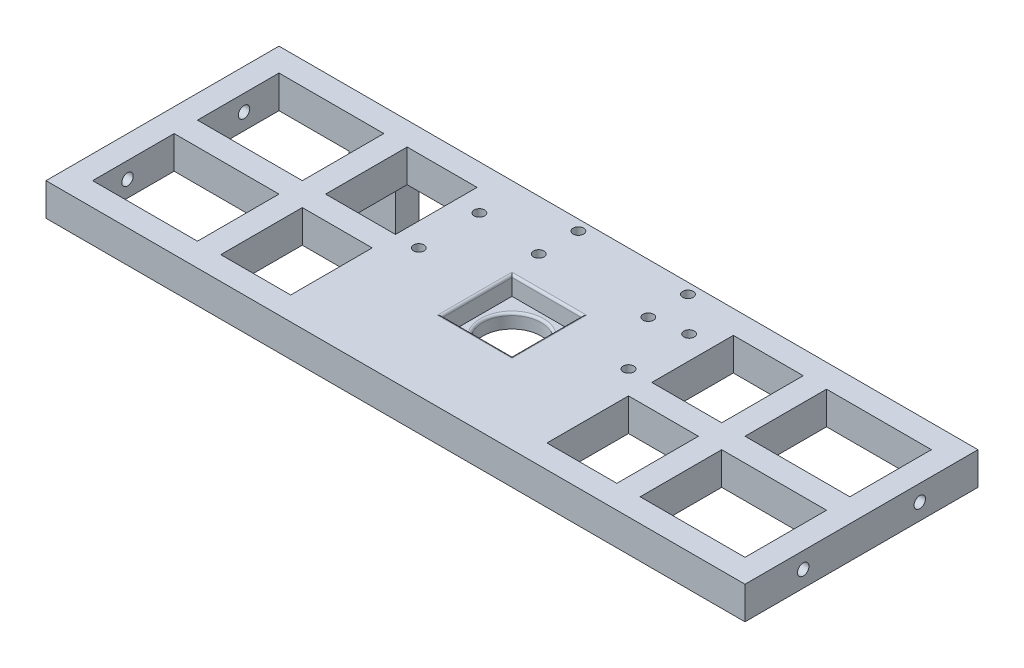
from build123d import *

# Parameters (mm, degrees)
SKETCH_1_W           = 300
SKETCH_1_H           = 100
EXTRUDE_1_DEPTH      = 16
SKETCH_2_W           = 30
SKETCH_2_H           = 30
CUT_EXTRUDE_1_DEPTH  = 8
SKETCH_3_R           = 12.5
CUT_EXTRUDE_2_DEPTH  = 14
CUT_EXTRUDE_3_REACH  = 318.632
SKETCH_4_W           = 50
SKETCH_4_H           = 35
SKETCH_7_W           = 35
SKETCH_7_H           = 16
EXTRUDE_2_DEPTH      = 20
SKETCH_8_W           = 35
SKETCH_8_H           = 16
EXTRUDE_3_DEPTH      = 20
SKETCH_9_W           = 20
SKETCH_9_H           = 10
EXTRUDE_4_DEPTH      = 25
FILLET_1_R           = 1
FILLET_2_R           = 1
SKETCH_13_W          = 35
SKETCH_13_H          = 16
EXTRUDE_6_DEPTH      = 4
SKETCH_14_W          = 35
SKETCH_14_H          = 16
EXTRUDE_7_DEPTH      = 4
SKETCH_17_W          = 35
SKETCH_17_H          = 16
EXTRUDE_8_DEPTH      = 1
SKETCH_18_W          = 35
SKETCH_18_H          = 16
EXTRUDE_9_DEPTH      = 1
CUT_EXTRUDE_15_DEPTH = 2
SKETCH_28_R          = 2.25
CUT_EXTRUDE_18_DEPTH = 5
SKETCH_30_R          = 1.5
CUT_EXTRUDE_20_DEPTH = 4
SKETCH_33_R          = 2.45
CUT_EXTRUDE_22_DEPTH = 13.2
CUT_EXTRUDE_START    = -13.2
SKETCH_34_R          = 2.45
CUT_EXTRUDE_23_DEPTH = 13.2


with BuildPart() as part:
    # 草图1 → 凸台-拉伸1 (new body)
    with BuildSketch(Plane(origin=(0, 0, 0), x_dir=(1, 0, 0), z_dir=(0, 1, 0))):
        with Locations((-150, 50)):
            Rectangle(SKETCH_1_W, SKETCH_1_H)
    extrude(amount=EXTRUDE_1_DEPTH)

    # 草图2 → 切除-拉伸1 (cut)
    with BuildSketch(Plane(origin=(0, 16, 0), x_dir=(1, 0, 0), z_dir=(0, 1, 0))):
        with Locations((-150, 50)):
            Rectangle(SKETCH_2_W, SKETCH_2_H)
    extrude(amount=-CUT_EXTRUDE_1_DEPTH, mode=Mode.SUBTRACT)

    # 草图3 → 切除-拉伸2 (cut)
    with BuildSketch(Plane(origin=(0, 8, 0), x_dir=(1, 0, 0), z_dir=(0, 1, 0))):
        with Locations((-150, 50)):
            Circle(SKETCH_3_R)
    extrude(amount=-CUT_EXTRUDE_2_DEPTH, mode=Mode.SUBTRACT)

    # 草图4 → 切除-拉伸3 (cut, up to next)
    with BuildSketch(Plane(origin=(0, 16, 0), x_dir=(1, 0, 0), z_dir=(0, 1, 0)), mode=Mode.PRIVATE) as cut_extrude_3_sk1:
        with Locations((-270, 72.5)):
            Rectangle(SKETCH_4_W, SKETCH_4_H)
    cut_extrude_3_tool1 = extrude(cut_extrude_3_sk1.sketch, amount=-CUT_EXTRUDE_3_REACH, mode=Mode.PRIVATE) & part.part
    # 草图4 → 切除-拉伸3 (cut, up to next)
    with BuildSketch(Plane(origin=(0, 16, 0), x_dir=(1, 0, 0), z_dir=(0, 1, 0)), mode=Mode.PRIVATE) as cut_extrude_3_sk2:
        with Locations((-270, 27.5)):
            Rectangle(SKETCH_4_W, SKETCH_4_H)
    cut_extrude_3_tool2 = extrude(cut_extrude_3_sk2.sketch, amount=-CUT_EXTRUDE_3_REACH, mode=Mode.PRIVATE) & part.part
    # 草图4 → 切除-拉伸3 (cut, up to next)
    with BuildSketch(Plane(origin=(0, 16, 0), x_dir=(1, 0, 0), z_dir=(0, 1, 0)), mode=Mode.PRIVATE) as cut_extrude_3_sk3:
        with Locations((-210, 72.5)):
            Rectangle(SKETCH_4_W, SKETCH_4_H)
    cut_extrude_3_tool3 = extrude(cut_extrude_3_sk3.sketch, amount=-CUT_EXTRUDE_3_REACH, mode=Mode.PRIVATE) & part.part
    # 草图4 → 切除-拉伸3 (cut, up to next)
    with BuildSketch(Plane(origin=(0, 16, 0), x_dir=(1, 0, 0), z_dir=(0, 1, 0)), mode=Mode.PRIVATE) as cut_extrude_3_sk4:
        with Locations((-210, 27.5)):
            Rectangle(SKETCH_4_W, SKETCH_4_H)
    cut_extrude_3_tool4 = extrude(cut_extrude_3_sk4.sketch, amount=-CUT_EXTRUDE_3_REACH, mode=Mode.PRIVATE) & part.part
    # 草图4 → 切除-拉伸3 (cut, up to next)
    with BuildSketch(Plane(origin=(0, 16, 0), x_dir=(1, 0, 0), z_dir=(0, 1, 0)), mode=Mode.PRIVATE) as cut_extrude_3_sk5:
        with Locations((-30, 27.5)):
            Rectangle(SKETCH_4_W, SKETCH_4_H)
    cut_extrude_3_tool5 = extrude(cut_extrude_3_sk5.sketch, amount=-CUT_EXTRUDE_3_REACH, mode=Mode.PRIVATE) & part.part
    # 草图4 → 切除-拉伸3 (cut, up to next)
    with BuildSketch(Plane(origin=(0, 16, 0), x_dir=(1, 0, 0), z_dir=(0, 1, 0)), mode=Mode.PRIVATE) as cut_extrude_3_sk6:
        with Locations((-90, 27.5)):
            Rectangle(SKETCH_4_W, SKETCH_4_H)
    cut_extrude_3_tool6 = extrude(cut_extrude_3_sk6.sketch, amount=-CUT_EXTRUDE_3_REACH, mode=Mode.PRIVATE) & part.part
    # 草图4 → 切除-拉伸3 (cut, up to next)
    with BuildSketch(Plane(origin=(0, 16, 0), x_dir=(1, 0, 0), z_dir=(0, 1, 0)), mode=Mode.PRIVATE) as cut_extrude_3_sk7:
        with Locations((-90, 72.5)):
            Rectangle(SKETCH_4_W, SKETCH_4_H)
    cut_extrude_3_tool7 = extrude(cut_extrude_3_sk7.sketch, amount=-CUT_EXTRUDE_3_REACH, mode=Mode.PRIVATE) & part.part
    # 草图4 → 切除-拉伸3 (cut, up to next)
    with BuildSketch(Plane(origin=(0, 16, 0), x_dir=(1, 0, 0), z_dir=(0, 1, 0)), mode=Mode.PRIVATE) as cut_extrude_3_sk8:
        with Locations((-30, 72.5)):
            Rectangle(SKETCH_4_W, SKETCH_4_H)
    cut_extrude_3_tool8 = extrude(cut_extrude_3_sk8.sketch, amount=-CUT_EXTRUDE_3_REACH, mode=Mode.PRIVATE) & part.part
    add(cut_extrude_3_tool1.solids().sort_by_distance((-270, 16, -72.5))[0], mode=Mode.SUBTRACT)
    add(cut_extrude_3_tool2.solids().sort_by_distance((-270, 16, -27.5))[0], mode=Mode.SUBTRACT)
    add(cut_extrude_3_tool3.solids().sort_by_distance((-210, 16, -72.5))[0], mode=Mode.SUBTRACT)
    add(cut_extrude_3_tool4.solids().sort_by_distance((-210, 16, -27.5))[0], mode=Mode.SUBTRACT)
    add(cut_extrude_3_tool5.solids().sort_by_distance((-30, 16, -27.5))[0], mode=Mode.SUBTRACT)
    add(cut_extrude_3_tool6.solids().sort_by_distance((-90, 16, -27.5))[0], mode=Mode.SUBTRACT)
    add(cut_extrude_3_tool7.solids().sort_by_distance((-90, 16, -72.5))[0], mode=Mode.SUBTRACT)
    add(cut_extrude_3_tool8.solids().sort_by_distance((-30, 16, -72.5))[0], mode=Mode.SUBTRACT)

    # 草图7 → 凸台-拉伸2 (add)
    with BuildSketch(Plane.ZY.offset(185)):
        with Locations((-27.5, 8)):
            Rectangle(SKETCH_7_W, SKETCH_7_H)
        with Locations((-72.5, 8)):
            Rectangle(SKETCH_7_W, SKETCH_7_H)
    extrude(amount=EXTRUDE_2_DEPTH)

    # 草图8 → 凸台-拉伸3 (add)
    with BuildSketch(Plane(origin=(-115, 0, 0), x_dir=(0, 0, -1), z_dir=(1, 0, 0))):
        with Locations((27.5, 8)):
            Rectangle(SKETCH_8_W, SKETCH_8_H)
        with Locations((72.5, 8)):
            Rectangle(SKETCH_8_W, SKETCH_8_H)
    extrude(amount=EXTRUDE_3_DEPTH)

    # 草图9 → 凸台-拉伸4 (add)
    with BuildSketch(Plane.XZ):
        with Locations((-250, -95)):
            Rectangle(SKETCH_9_W, SKETCH_9_H)
    extrude(amount=EXTRUDE_4_DEPTH)

    # 圆角1
    fillet_1_edges = [part.edges().sort_by_distance(p)[0] for p in [
        (-162.5, 8, -50),
    ]]
    fillet(fillet_1_edges, radius=FILLET_1_R)

    # 圆角2
    fillet_2_edges = [part.edges().sort_by_distance(p)[0] for p in [
        (-135, 16, -50),
        (-150, 16, -65),
        (-150, 16, -35),
        (-165, 16, -50),
    ]]
    fillet(fillet_2_edges, radius=FILLET_2_R)

    # 草图13 → 凸台-拉伸6 (add)
    with BuildSketch(Plane.ZY.offset(5)):
        with Locations((-72.5, 8)):
            Rectangle(SKETCH_13_W, SKETCH_13_H)
        with Locations((-27.5, 8)):
            Rectangle(SKETCH_13_W, SKETCH_13_H)
    extrude(amount=EXTRUDE_6_DEPTH)

    # 草图14 → 凸台-拉伸7 (add)
    with BuildSketch(Plane(origin=(-295, 0, 0), x_dir=(0, 0, -1), z_dir=(1, 0, 0))):
        with Locations((72.5, 8)):
            Rectangle(SKETCH_14_W, SKETCH_14_H)
        with Locations((27.5, 8)):
            Rectangle(SKETCH_14_W, SKETCH_14_H)
    extrude(amount=EXTRUDE_7_DEPTH)

    # 草图17 → 凸台-拉伸8 (add)
    with BuildSketch(Plane(origin=(-291, 0, 0), x_dir=(0, 0, -1), z_dir=(1, 0, 0))):
        with Locations((27.5, 8)):
            Rectangle(SKETCH_17_W, SKETCH_17_H)
        with Locations((72.5, 8)):
            Rectangle(SKETCH_17_W, SKETCH_17_H)
    extrude(amount=EXTRUDE_8_DEPTH)

    # 草图18 → 凸台-拉伸9 (add)
    with BuildSketch(Plane.ZY.offset(9)):
        with Locations((-27.5, 8)):
            Rectangle(SKETCH_18_W, SKETCH_18_H)
        with Locations((-72.5, 8)):
            Rectangle(SKETCH_18_W, SKETCH_18_H)
    extrude(amount=EXTRUDE_9_DEPTH)

    # 草图26 → 切除-拉伸15 (cut)
    with BuildSketch(Plane.XZ):
        Polygon((-260, -90), (-290, -90), (-290, -55), (-245, -55), (-245, -90), (-240, -90), (-240, -100), (0, -100), (0, 0), (-300, 0), (-300, -100), (-260, -100), align=None)
    extrude(amount=-CUT_EXTRUDE_15_DEPTH, mode=Mode.SUBTRACT)

    # 草图28 → 切除-拉伸18 (cut)
    with BuildSketch(Plane(origin=(0, 16, 0), x_dir=(1, 0, 0), z_dir=(0, 1, 0))):
        with Locations((-105.002761288, 55.000000147)):
            Circle(SKETCH_28_R)
        with Locations((-105, 81)):
            Circle(SKETCH_28_R)
        with Locations((-120, 78.499971194)):
            Circle(SKETCH_28_R)
        with Locations((-120, 95.5)):
            Circle(SKETCH_28_R)
        with Locations((-167.000079641, 78.5)):
            Circle(SKETCH_28_R)
        with Locations((-167.000079641, 95.5)):
            Circle(SKETCH_28_R)
        with Locations((-195, 54.99995086)):
            Circle(SKETCH_28_R)
        with Locations((-195, 81)):
            Circle(SKETCH_28_R)
    extrude(amount=-CUT_EXTRUDE_18_DEPTH, mode=Mode.SUBTRACT)

    # 草图30 → 切除-拉伸20 (cut)
    with BuildSketch(Plane(origin=(0, 11, 0), x_dir=(1, 0, 0), z_dir=(0, 1, 0))):
        with Locations((-195, 81)):
            Circle(SKETCH_30_R)
        with Locations((-195, 54.99995086)):
            Circle(SKETCH_30_R)
        with Locations((-167.000079641, 95.5)):
            Circle(SKETCH_30_R)
        with Locations((-167.000079641, 78.5)):
            Circle(SKETCH_30_R)
        with Locations((-120, 95.5)):
            Circle(SKETCH_30_R)
        with Locations((-120, 78.499971194)):
            Circle(SKETCH_30_R)
        with Locations((-105, 81)):
            Circle(SKETCH_30_R)
        with Locations((-105.002761288, 55.000000147)):
            Circle(SKETCH_30_R)
    extrude(amount=-CUT_EXTRUDE_20_DEPTH, mode=Mode.SUBTRACT)

    # 草图33 → 切除-拉伸22 (cut)
    with BuildSketch(Plane.ZY.offset(300)):
        with Locations((-75, 9)):
            Circle(SKETCH_33_R)
        with Locations((-25, 9)):
            Circle(SKETCH_33_R)
    extrude(amount=-CUT_EXTRUDE_22_DEPTH, mode=Mode.SUBTRACT)

    # 草图34 → 切除-拉伸23 (cut)
    with BuildSketch(Plane(origin=(0, 0, 0), x_dir=(0, 0, -1), z_dir=(1, 0, 0)).offset(CUT_EXTRUDE_START)):
        with Locations((75, 9)):
            Circle(SKETCH_34_R)
        with Locations((25, 9)):
            Circle(SKETCH_34_R)
    extrude(amount=CUT_EXTRUDE_23_DEPTH, mode=Mode.SUBTRACT)


solid = part.part
